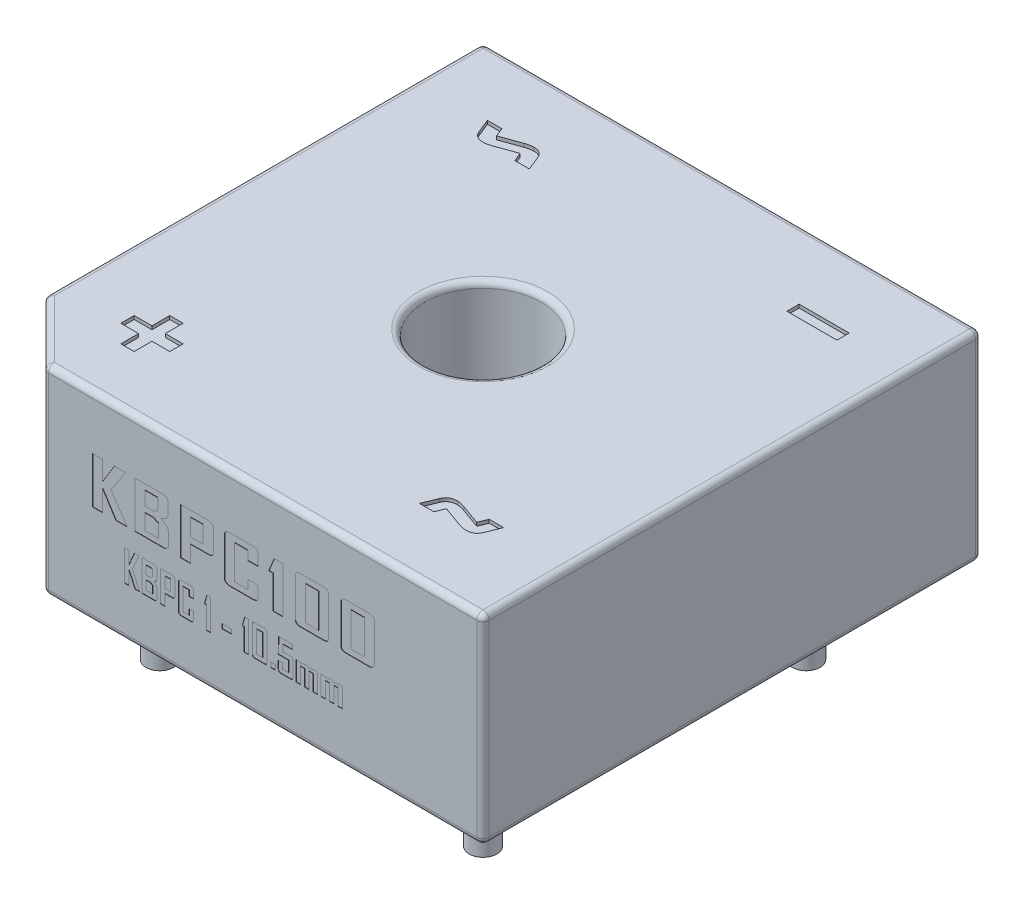
from build123d import *

# Parameters (mm, degrees)
BODY_SKETCH_R          = 1.9
BODY_MAIN_DEPTH        = 6.5
BODY_CHAMFER_SIZE      = 2
SKETCH24_R             = 2.399999999999998
BODY_CUT_DEPTH         = 2
BODY_REVOLVE_CUT_REACH = 24.048
BODY_FILLET_R          = 0.2
PIN_B1_SKETCH_R        = 0.45
CIRPATTERN1_COUNT      = 4
TEXT_START             = 2.84
TEXT_2_OUTLINE_W       = 0.4337349400000008
TEXT_2_OUTLINE_H       = 1.1024096379999997
TEXT_2_OUTLINE_W_2     = 0.3975903619999994
TEXT_2_OUTLINE_H_2     = 0.5602409640000001
TEXT_2_OUTLINE_W_3     = 0.18072289099999939
TEXT_2_OUTLINE_H_3     = 0.3493975909999998
TEXT_2_OUTLINE_W_4     = 0.1927710840000012
TEXT_2_OUTLINE_H_4     = 0.7108433739999998
TEXT_2_OUTLINE_W_5     = 0.14457831299999846
TEXT_2_OUTLINE_H_5     = 0.15662650599999983
TEXT_2_OUTLINE_W_6     = 0.3012048189999996
TEXT_2_OUTLINE_H_6     = 0.14457831399999987
TEXT_2_DEPTH           = 0.01
SKETCH23_W             = 1.6265060240963845
SKETCH23_H             = 0.39759036144578275
TEXT1_DEPTH            = 0.11
PIN1_MARK_DEPTH        = 0.04


# Read off the part's stored shape, not the designer's step: text
with BuildPart() as part:
    # BODY_Sketch → BODY_MAIN (new body)
    with BuildSketch(Plane(origin=(0, 0.1, 0), x_dir=(1, 0, 0), z_dir=(0, 1, 0))):
        Polygon((-2.8499999999999983, 13.35), (13.350000000000001, 13.350000000000001), (13.350000000000003, -2.8499999999999996), (-2.850000000000003, -2.8499999999999996), align=None)
        with Locations(Location((5.250000000000002, 5.249999999999999, 0), (0, 0, 90))):
            Circle(BODY_SKETCH_R, mode=Mode.SUBTRACT)
    extrude(amount=BODY_MAIN_DEPTH)

    # BODY_Chamfer
    body_chamfer_edges = [part.edges().sort_by_distance(p)[0] for p in [
        (-2.850000000000003, 3.35, 2.8499999999999996),
    ]]
    chamfer(body_chamfer_edges, length=BODY_CHAMFER_SIZE)

    # Sketch24 → BODY_Cut (cut)
    with BuildSketch(Plane(origin=(0, 0.1, 0), x_dir=(1, 0, 0), z_dir=(0, 1, 0))):
        Polygon((-0.4357864376269056, -1.8500000000000005), (12.350000000000003, -1.8499999999999996), (12.350000000000003, 12.35), (-1.8500000000000043, 12.349999999999996), (-1.8500000000000028, -0.43578643762689756), align=None)
        with Locations(Location((5.250000000000002, 5.249999999999999, 0), (0, 0, 270))):
            Circle(SKETCH24_R, mode=Mode.SUBTRACT)
    extrude(amount=BODY_CUT_DEPTH, mode=Mode.SUBTRACT)

    # Sketch26 → BODY_Revolve (revolve)
    with BuildSketch(Plane(origin=(0, 0, 0), x_dir=(0, -1, 0), z_dir=(0.707106781186546, 0, 0.707106781186549)), mode=Mode.PRIVATE) as body_revolve_sk:
        with BuildLine():
            Line((-0.39999999999999997, 17.46553749530773), (-2.3, 17.46553749530773))
            Line((-2.3, 17.46553749530773), (-2.299999999999999, 9.82462120245875))
            Line((-2.299999999999999, 9.82462120245875), (-0.39999999999999997, 9.82462120245875))
            add(Edge.make_bspline(
                [(-0.39999999999999997, 17.46553749530773), (-0.39999999999999997, 16.813199498951743), (-0.7883895517261408, 13.473585710075339), (-3.4344289772850907, 10.457207300253984), (-0.39999999999999997, 9.82462120245875)],
                knots=[0, 0, 0, 0, 0.3191160015862243, 1, 1, 1, 1], degree=3))
        make_face()
    revolve(body_revolve_sk.sketch.rotate(Axis((5.250000000000002, 10.74916955753597, -5.249999999999999), (0, -1, 0)), 135), axis=Axis((5.250000000000002, 10.74916955753597, -5.249999999999999), (0, -1, 0)))

    # Sketch28 → BODY_Revolve_Cut (cut, up to next)
    with BuildSketch(Plane(origin=(0, 2.2999999999999994, 0), x_dir=(1, 0, 0), z_dir=(0, 1, 0)), mode=Mode.PRIVATE) as body_revolve_cut_sk1:
        with BuildLine():
            Line((-2.8499999999999974, -0.6838014796587246), (-2.8499999999999956, 11.183801479658726))
            ThreePointArc((-2.8499999999999956, 11.183801479658726), (-4.790916292848976, 5.25), (-2.8499999999999974, -0.6838014796587246))
        make_face()
    body_revolve_cut_tool1 = extrude(body_revolve_cut_sk1.sketch, amount=-BODY_REVOLVE_CUT_REACH, mode=Mode.PRIVATE) & part.part
    # Sketch28 → BODY_Revolve_Cut (cut, up to next)
    with BuildSketch(Plane(origin=(0, 2.2999999999999994, 0), x_dir=(1, 0, 0), z_dir=(0, 1, 0)), mode=Mode.PRIVATE) as body_revolve_cut_sk2:
        with BuildLine():
            Line((13.350000000000001, 11.183801479658724), (13.350000000000005, -0.6838014796587202))
            ThreePointArc((13.350000000000005, -0.6838014796587202), (15.29091629284898, 5.250000000000003), (13.350000000000001, 11.183801479658724))
        make_face()
    body_revolve_cut_tool2 = extrude(body_revolve_cut_sk2.sketch, amount=-BODY_REVOLVE_CUT_REACH, mode=Mode.PRIVATE) & part.part
    # Sketch28 → BODY_Revolve_Cut (cut, up to next)
    with BuildSketch(Plane(origin=(0, 2.2999999999999994, 0), x_dir=(1, 0, 0), z_dir=(0, 1, 0)), mode=Mode.PRIVATE) as body_revolve_cut_sk3:
        with BuildLine():
            Line((11.183801479658733, -2.8499999999999948), (-0.6838014796587237, -2.8499999999999983))
            ThreePointArc((-0.6838014796587237, -2.8499999999999983), (5.250000000000004, -4.790916292848979), (11.183801479658733, -2.8499999999999948))
        make_face()
    body_revolve_cut_tool3 = extrude(body_revolve_cut_sk3.sketch, amount=-BODY_REVOLVE_CUT_REACH, mode=Mode.PRIVATE) & part.part
    # Sketch28 → BODY_Revolve_Cut (cut, up to next)
    with BuildSketch(Plane(origin=(0, 2.2999999999999994, 0), x_dir=(1, 0, 0), z_dir=(0, 1, 0)), mode=Mode.PRIVATE) as body_revolve_cut_sk4:
        with BuildLine():
            ThreePointArc((11.183801479658726, 13.350000000000001), (5.249999999999998, 15.29091629284898), (-0.6838014796587297, 13.349999999999994))
            Line((-0.6838014796587297, 13.349999999999994), (11.183801479658726, 13.350000000000001))
        make_face()
    body_revolve_cut_tool4 = extrude(body_revolve_cut_sk4.sketch, amount=-BODY_REVOLVE_CUT_REACH, mode=Mode.PRIVATE) & part.part
    add(body_revolve_cut_tool1.solids().sort_by_distance((-3.63318, 2.3, -5.25))[0], mode=Mode.SUBTRACT)
    add(body_revolve_cut_tool2.solids().sort_by_distance((14.13318, 2.3, -5.25))[0], mode=Mode.SUBTRACT)
    add(body_revolve_cut_tool3.solids().sort_by_distance((5.25, 2.3, 3.63318))[0], mode=Mode.SUBTRACT)
    add(body_revolve_cut_tool4.solids().sort_by_distance((5.25, 2.3, -14.13318))[0], mode=Mode.SUBTRACT)

    # BODY_Fillet
    body_fillet_edges = [part.edges().sort_by_distance(p)[0] for p in [
        (5.250000000000002, 6.6, -3.349999999999999),
        (13.350000000000001, 6.6, -5.25),
        (5.250000000000002, 6.6, -13.350000000000001),
        (6.250000000000001, 0.1, 2.8499999999999996),
        (6.250000000000001, 6.6, 2.8499999999999996),
        (-0.8500000000000032, 3.35, 2.8499999999999996),
        (-1.850000000000003, 0.1, 1.8499999999999994),
        (-2.8500000000000028, 3.35, 0.8499999999999996),
        (-1.850000000000003, 6.6, 1.8499999999999994),
        (-2.8500000000000005, 6.6, -6.249999999999998),
        (5.250000000000002, 0.1, -13.350000000000001),
        (13.350000000000001, 0.1, -5.25),
        (-2.8500000000000005, 0.1, -6.249999999999998),
        (-2.8499999999999983, 3.35, -13.35),
        (13.350000000000001, 3.35, -13.350000000000001),
        (13.350000000000003, 3.35, 2.8499999999999996),
    ]]
    fillet(body_fillet_edges, radius=BODY_FILLET_R)

    # PIN_Sweep: sweep along a path in PIN_B1_Path
    with BuildLine(Plane(origin=(0, 0, 0), x_dir=(0, 0, -1), z_dir=(1, 0, 0))) as pin_sweep_path:
        Line((0, -2.7), (0, 0))
        Line((0, 0), (0, 3.35))
    # PIN_B1_Sketch → PIN_Sweep (sweep)
    with BuildSketch(Plane(origin=(0, 0, 0), x_dir=(1, 0, 0), z_dir=(0, 1, 0))):
        Circle(PIN_B1_SKETCH_R)
    pin_sweep = sweep(path=pin_sweep_path.line)

    # CirPattern1: PIN_Sweep ×4 about axis
    cirpattern1_axis = Axis((5.249999999999993, 0, -5.25000000000001), (0, 1, 0))
    for i in range(1, CIRPATTERN1_COUNT):
        add(pin_sweep.rotate(cirpattern1_axis, i * 360 / CIRPATTERN1_COUNT))

    # text 2 outline → text 2 (cut)
    # profile 1 of 19: a face of its own
    with BuildSketch(Plane.XY.offset(TEXT_START)):
        with BuildLine():
            add(Edge.make_bspline(
                [(8.225903614, 2.330421687), (8.24190584768579, 2.33393243810223), (8.27385045293119, 2.34094080778165), (8.30578636434366, 2.34798868768132), (8.321724398, 2.351506024)],
                knots=[0, 0, 0, 0, 0.500936953361181, 1, 1, 1, 1], degree=3))
            Line((8.225903614, 2.330421687), (8.225903614, 2.363554217))
            Line((8.225903614, 2.363554217), (8.081325301, 2.363554217))
            Line((8.081325301, 2.363554217), (8.081325301, 1.725))
            Line((8.081325301, 1.725), (8.225903614, 1.725))
            Line((8.225903614, 1.725), (8.225903614, 2.241566265))
            Line((8.225903614, 2.241566265), (8.358433735, 2.243072289))
            Line((8.358433735, 2.243072289), (8.358433735, 1.725))
            Line((8.358433735, 1.725), (8.503012048, 1.725))
            Line((8.503012048, 1.725), (8.503012048, 2.241566265))
            Line((8.503012048, 2.241566265), (8.635542169, 2.243072289))
            Line((8.635542169, 2.243072289), (8.635542169, 1.725))
            Line((8.635542169, 1.725), (8.780120482, 1.725))
            Line((8.780120482, 1.725), (8.780120482, 2.284676205))
            add(Edge.make_bspline(
                [(8.695783133, 2.363554217), (8.70226776068473, 2.36325355288355), (8.71455329959077, 2.3626839259159), (8.73173832037393, 2.35878163217726), (8.74639139951268, 2.35231833357494), (8.75859339727807, 2.34357000728016), (8.76817915930402, 2.33220318329239), (8.7749263598296, 2.31836984299257), (8.77906801711136, 2.30222464266363), (8.77975763350906, 2.29072621506447), (8.780120482, 2.284676205)],
                knots=[0, 0, 0, 0, 0.148290832231006, 0.280946377394036, 0.400455298252146, 0.512425210819121, 0.621411208360218, 0.736958175519038, 0.861597969000499, 1, 1, 1, 1], degree=3))
            add(Edge.make_bspline(
                [(8.592055723, 2.349246988), (8.60264748505904, 2.35138960275253), (8.62252258457003, 2.35541015020298), (8.6504509071617, 2.35996172030027), (8.67445248768333, 2.36281978292006), (8.68912569488446, 2.36332499509547), (8.695783133, 2.363554217)],
                knots=[0, 0, 0, 0, 0.309141696941326, 0.580094406630043, 0.809483007592707, 1, 1, 1, 1], degree=3))
            add(Edge.make_bspline(
                [(8.489646084, 2.327786145), (8.50672064648074, 2.33127018950451), (8.54089499202703, 2.33824342572614), (8.57499375744337, 2.34557732969383), (8.592055723, 2.349246988)],
                knots=[0, 0, 0, 0, 0.499630991331246, 1, 1, 1, 1], degree=3))
            add(Edge.make_bspline(
                [(8.418674699, 2.363554217), (8.42307398444154, 2.36345916316602), (8.43146915671051, 2.36327777185329), (8.44345946533576, 2.36154937926013), (8.45425247825625, 2.35882831102509), (8.46376034511574, 2.35477784178207), (8.47229204843807, 2.34992069330966), (8.47939286918083, 2.34363073126407), (8.48553600423765, 2.3363675507827), (8.48825828656351, 2.33068371740852), (8.489646084, 2.327786145)],
                knots=[0, 0, 0, 0, 0.156270314249307, 0.29821119020433, 0.429671568138866, 0.550627586343719, 0.664617534396412, 0.776870433033137, 0.886250329962607, 1, 1, 1, 1], degree=3))
            add(Edge.make_bspline(
                [(8.321724398, 2.351506024), (8.33099710542357, 2.35334661551598), (8.34873221052587, 2.3568669552985), (8.37423996266241, 2.36057801581408), (8.3972910400412, 2.36304869994827), (8.41182954225714, 2.3633923950537), (8.418674699, 2.363554217)],
                knots=[0, 0, 0, 0, 0.289803377693954, 0.554281818736332, 0.790142706773658, 1, 1, 1, 1], degree=3))
        make_face()
    # profile 2 of 19: a face of its own
    with BuildSketch(Plane.XY.offset(TEXT_START)):
        with BuildLine():
            add(Edge.make_bspline(
                [(7.418674699, 2.330421687), (7.43467693202314, 2.33393243810223), (7.46662153726854, 2.34094080778165), (7.49855744868101, 2.34798868768132), (7.514495482, 2.351506024)],
                knots=[0, 0, 0, 0, 0.500936953361177, 1, 1, 1, 1], degree=3))
            Line((7.418674699, 2.330421687), (7.418674699, 2.363554217))
            Line((7.418674699, 2.363554217), (7.274096386, 2.363554217))
            Line((7.274096386, 2.363554217), (7.274096386, 1.725))
            Line((7.274096386, 1.725), (7.418674699, 1.725))
            Line((7.418674699, 1.725), (7.418674699, 2.241566265))
            Line((7.418674699, 2.241566265), (7.551204819, 2.243072289))
            Line((7.551204819, 2.243072289), (7.551204819, 1.725))
            Line((7.551204819, 1.725), (7.695783133, 1.725))
            Line((7.695783133, 1.725), (7.695783133, 2.241566265))
            Line((7.695783133, 2.241566265), (7.828313253, 2.243072289))
            Line((7.828313253, 2.243072289), (7.828313253, 1.725))
            Line((7.828313253, 1.725), (7.972891566, 1.725))
            Line((7.972891566, 1.725), (7.972891566, 2.284676205))
            add(Edge.make_bspline(
                [(7.888554217, 2.363554217), (7.89503884502207, 2.36325355288355), (7.90732438392812, 2.3626839259159), (7.92450940471128, 2.35878163217726), (7.93916248385003, 2.35231833357494), (7.95136448161541, 2.34357000728016), (7.96095024364137, 2.33220318329239), (7.96769744416695, 2.31836984299257), (7.97183910144871, 2.30222464266363), (7.97252871784641, 2.29072621506447), (7.972891566, 2.284676205)],
                knots=[0, 0, 0, 0, 0.148290832231005, 0.280946377394034, 0.400455298252144, 0.512425210819117, 0.621411208360223, 0.736958175519036, 0.8615979690005, 1, 1, 1, 1], degree=3))
            add(Edge.make_bspline(
                [(7.784826807, 2.349246988), (7.79541856939639, 2.35138960275253), (7.81529366890739, 2.35541015020298), (7.84322199149905, 2.35996172030027), (7.86722357202068, 2.36281978292006), (7.8818967792218, 2.36332499509547), (7.888554217, 2.363554217)],
                knots=[0, 0, 0, 0, 0.309141696941331, 0.580094406630036, 0.809483007592721, 1, 1, 1, 1], degree=3))
            add(Edge.make_bspline(
                [(7.682417169, 2.327786145), (7.69949173081809, 2.33127018950451), (7.73366607636438, 2.33824342572614), (7.76776484178072, 2.34557732969383), (7.784826807, 2.349246988)],
                knots=[0, 0, 0, 0, 0.499630991331243, 1, 1, 1, 1], degree=3))
            add(Edge.make_bspline(
                [(7.611445783, 2.363554217), (7.61584506877889, 2.36345916316602), (7.62424024104786, 2.36327777185329), (7.63623054967311, 2.36154937926013), (7.6470235625936, 2.35882831102509), (7.65653142945309, 2.35477784178208), (7.66506313277541, 2.34992069330966), (7.67216395351818, 2.34363073126407), (7.678307088575, 2.3363675507827), (7.68102937090086, 2.33068371740852), (7.682417169, 2.327786145)],
                knots=[0, 0, 0, 0, 0.156270314249308, 0.298211190204312, 0.429671568138869, 0.550627586343714, 0.664617534396416, 0.776870433033127, 0.886250329962611, 1, 1, 1, 1], degree=3))
            add(Edge.make_bspline(
                [(7.514495482, 2.351506024), (7.52376818976092, 2.35334661551598), (7.54150329486322, 2.3568669552985), (7.56701104699976, 2.36057801581408), (7.59006212437855, 2.36304869994827), (7.60460062659449, 2.3633923950537), (7.611445783, 2.363554217)],
                knots=[0, 0, 0, 0, 0.289803377693954, 0.554281818736314, 0.790142706773641, 1, 1, 1, 1], degree=3))
        make_face()
    # profile 3 of 19: a face of its own
    with BuildSketch(Plane.XY.offset(TEXT_START)):
        with BuildLine():
            add(Edge.make_bspline(
                [(2.756024096, 1.803878012), (2.75559879858627, 1.79788560457128), (2.75479550749926, 1.7865673059012), (2.75053333728877, 1.77078821280164), (2.74427941201808, 1.75706560178845), (2.73505939260662, 1.74596470377893), (2.72395849459709, 1.73674468436746), (2.71023588358391, 1.73049075909677), (2.69445679048435, 1.72622858888628), (2.68313849181426, 1.72542529779928), (2.677146084, 1.725)],
                knots=[0, 0, 0, 0, 0.143087679268516, 0.270260174430613, 0.388177209713557, 0.5, 0.611822790286443, 0.729739825569386, 0.856912320731484, 1, 1, 1, 1], degree=3))
            Line((2.756024096, 1.803878012), (2.756024096, 2.083245482))
            add(Edge.make_bspline(
                [(2.722703313, 2.174548193), (2.72781842035597, 2.1686584188302), (2.73814232169366, 2.15677099519602), (2.74865968905762, 2.13485982670836), (2.7549988592483, 2.11002230482141), (2.75567171297743, 2.09244892156813), (2.756024096, 2.083245482)],
                knots=[0, 0, 0, 0, 0.233880582320335, 0.472044867893607, 0.7235021212956, 1, 1, 1, 1], degree=3))
            add(Edge.make_bspline(
                [(2.645143072, 2.231024096), (2.65091855466293, 2.22694867983093), (2.66173038487503, 2.21931941027723), (2.6768044212292, 2.20860784160626), (2.68961689740409, 2.19931160996563), (2.70041996202014, 2.191631346823), (2.70902816968494, 2.18521987589506), (2.71557651467794, 2.18036137158709), (2.71999642002701, 2.1770709770193), (2.72202055077172, 2.17518451725427), (2.722703313, 2.174548193)],
                knots=[0, 0, 0, 0, 0.220969594522985, 0.413659947932666, 0.578075155223177, 0.715809510259433, 0.828017935537188, 0.913546243142883, 0.970838157711319, 1, 1, 1, 1], degree=3))
            add(Edge.make_bspline(
                [(2.720256024, 2.285240964), (2.71957651416631, 2.28460039570173), (2.71758970104083, 2.28272744409473), (2.71320318027765, 2.27974556055693), (2.70690712124066, 2.2751403827941), (2.69877022531476, 2.26882415263679), (2.68804925739044, 2.26171883520456), (2.67575613429082, 2.25244822216429), (2.66106218873843, 2.24228393443886), (2.650657891934, 2.23492481388403), (2.645143072, 2.231024096)],
                knots=[0, 0, 0, 0, 0.0302026419391957, 0.0883092398981999, 0.171209504373829, 0.282950229840026, 0.421594496871916, 0.587395025823174, 0.781297856076047, 1, 1, 1, 1], degree=3))
            add(Edge.make_bspline(
                [(2.750941265, 2.372402108), (2.75064892653445, 2.3635104208022), (2.75009224757558, 2.3465786277724), (2.74402464646729, 2.32282169082364), (2.73469968433851, 2.30182472168322), (2.7250042767943, 2.29069275872788), (2.720256024, 2.285240964)],
                knots=[0, 0, 0, 0, 0.280887719554825, 0.534874022704701, 0.772208061755555, 1, 1, 1, 1], degree=3))
            Line((2.750941265, 2.372402108), (2.750941265, 2.646121988))
            add(Edge.make_bspline(
                [(2.674510542, 2.725), (2.68031294571671, 2.72456703565141), (2.69131758504206, 2.72374589033506), (2.70663579450862, 2.7195603690266), (2.7198668553339, 2.71318436384829), (2.73058993785839, 2.70403374858835), (2.73933101114601, 2.69280463924752), (2.74571193811479, 2.67925787798902), (2.749639195111, 2.66339403297413), (2.75049011585042, 2.65210651241494), (2.750941265, 2.646121988)],
                knots=[0, 0, 0, 0, 0.140866030848222, 0.267161677026218, 0.382887923616369, 0.494174249189976, 0.605917690048943, 0.725745796488272, 0.854593311132678, 1, 1, 1, 1], degree=3))
            Line((2.674510542, 2.725), (2.262048193, 2.725))
            Line((2.262048193, 2.725), (2.262048193, 1.725))
            Line((2.262048193, 1.725), (2.677146084, 1.725))
        make_face()
        Polygon((2.406626506, 1.869578313), (2.406626506, 2.15873494), (2.537085843, 2.15873494), (2.611445783, 2.116566265), (2.611445783, 1.869578313), align=None, mode=Mode.SUBTRACT)
        Polygon((2.606362952, 2.351694277), (2.534638554, 2.303313253), (2.406626506, 2.303313253), (2.406626506, 2.580421687), (2.606362952, 2.580421687), align=None, mode=Mode.SUBTRACT)
    # profile 4 of 19: a face of its own
    with BuildSketch(Plane.XY.offset(TEXT_START)):
        with BuildLine():
            add(Edge.make_bspline(
                [(9.818674699, 3.468317018), (9.8179099073138, 3.45927836518683), (9.8164430374544, 3.44194223133854), (9.80682840721585, 3.4179902618543), (9.79252116220684, 3.39723981914659), (9.77212016335209, 3.38074498502072), (9.74709686276185, 3.36726522178644), (9.71666660256924, 3.35805874977808), (9.68130254074218, 3.35183938714248), (9.65596033151996, 3.35063900240613), (9.64246988, 3.35)],
                knots=[0, 0, 0, 0, 0.11409833725196, 0.218840580729786, 0.322174175098222, 0.429434411702991, 0.547100707621026, 0.679564678015938, 0.829422238091859, 1, 1, 1, 1], degree=3))
            Line((9.818674699, 3.468317018), (9.818674699, 4.731682982))
            add(Edge.make_bspline(
                [(9.64246988, 4.85), (9.65596033151996, 4.84936099759387), (9.68130254074218, 4.84816061285752), (9.71666660256923, 4.84194125022192), (9.74709686276186, 4.83273477821356), (9.77212016335208, 4.81925501497928), (9.79252116220685, 4.80276018085341), (9.80682840721586, 4.78200973814569), (9.8164430374544, 4.75805776866146), (9.8179099073138, 4.74072163481317), (9.818674699, 4.731682982)],
                knots=[0, 0, 0, 0, 0.17057776190814, 0.320435321984061, 0.452899292378973, 0.57056558829701, 0.677825824901779, 0.781159419270213, 0.885901662748038, 1, 1, 1, 1], degree=3))
            Line((9.64246988, 4.85), (8.914777861, 4.85))
            add(Edge.make_bspline(
                [(8.734337349, 4.731682982), (8.73507654022301, 4.74073113617952), (8.73649714846614, 4.75812026233382), (8.74650612757087, 4.78202464607385), (8.76108420706564, 4.80287402614466), (8.78207431801412, 4.81924468779656), (8.80762809177734, 4.83272982903761), (8.83879080950893, 4.84200922633129), (8.875016107839, 4.84812164194811), (8.90100750118189, 4.84934948374423), (8.914777861, 4.85)],
                knots=[0, 0, 0, 0, 0.112348160712769, 0.215915454739921, 0.318343110637888, 0.425762474467419, 0.543690883577195, 0.676356301576123, 0.828532073458312, 1, 1, 1, 1], degree=3))
            Line((8.734337349, 4.731682982), (8.734337349, 3.468317018))
            add(Edge.make_bspline(
                [(8.910542169, 3.35), (8.89705171667282, 3.35063900240613), (8.87170950745061, 3.35183938714248), (8.83634544562355, 3.35805874977808), (8.80591518543092, 3.36726522178644), (8.78089188484069, 3.38074498502072), (8.76049088598593, 3.39723981914659), (8.74618364097692, 3.41799026185431), (8.73656901073837, 3.44194223133854), (8.73510214087898, 3.45927836518683), (8.734337349, 3.468317018)],
                knots=[0, 0, 0, 0, 0.17057776190814, 0.320435321984062, 0.452899292378974, 0.570565588297015, 0.677825824901779, 0.781159419270214, 0.88590166274804, 1, 1, 1, 1], degree=3))
            Line((8.910542169, 3.35), (9.64246988, 3.35))
        make_face()
        with Locations((9.276506024, 4.1000000000000005)):
            Rectangle(TEXT_2_OUTLINE_W, TEXT_2_OUTLINE_H, mode=Mode.SUBTRACT)
    # profile 5 of 19: a face of its own
    with BuildSketch(Plane.XY.offset(TEXT_START)):
        with BuildLine():
            add(Edge.make_bspline(
                [(8.334939759, 3.468317018), (8.33417496755477, 3.45927836518683), (8.33270809769537, 3.44194223133854), (8.32309346745682, 3.41799026185431), (8.3087862224478, 3.39723981914659), (8.28838522359305, 3.38074498502072), (8.26336192300282, 3.36726522178644), (8.2329316628102, 3.35805874977807), (8.19756760098314, 3.35183938714248), (8.17222539176092, 3.35063900240613), (8.15873494, 3.35)],
                knots=[0, 0, 0, 0, 0.114098337251959, 0.218840580729787, 0.322174175098222, 0.429434411702986, 0.547100707621027, 0.679564678015939, 0.829422238091853, 1, 1, 1, 1], degree=3))
            Line((8.334939759, 3.468317018), (8.334939759, 4.731682982))
            add(Edge.make_bspline(
                [(8.15873494, 4.85), (8.17222539176092, 4.84936099759387), (8.19756760098314, 4.84816061285752), (8.2329316628102, 4.84194125022192), (8.26336192300282, 4.83273477821356), (8.28838522359305, 4.81925501497928), (8.30878622244781, 4.80276018085341), (8.32309346745682, 4.78200973814569), (8.33270809769537, 4.75805776866146), (8.33417496755477, 4.74072163481317), (8.334939759, 4.731682982)],
                knots=[0, 0, 0, 0, 0.170577761908147, 0.32043532198406, 0.452899292378972, 0.570565588297015, 0.677825824901778, 0.781159419270211, 0.885901662748039, 1, 1, 1, 1], degree=3))
            Line((8.15873494, 4.85), (7.431042922, 4.85))
            add(Edge.make_bspline(
                [(7.25060241, 4.731682982), (7.25134160046397, 4.74073113617952), (7.2527622087071, 4.75812026233382), (7.26277118781183, 4.78202464607385), (7.2773492673066, 4.80287402614466), (7.29833937825508, 4.81924468779656), (7.3238931520183, 4.83272982903761), (7.35505586974989, 4.84200922633129), (7.39128116807996, 4.84812164194811), (7.41727256142286, 4.84934948374423), (7.431042922, 4.85)],
                knots=[0, 0, 0, 0, 0.112348160712769, 0.215915454739922, 0.318343110637891, 0.425762474467423, 0.543690883577197, 0.676356301576128, 0.828532073458315, 1, 1, 1, 1], degree=3))
            Line((7.25060241, 4.731682982), (7.25060241, 3.468317018))
            add(Edge.make_bspline(
                [(7.426807229, 3.35), (7.41331677691378, 3.35063900240613), (7.38797456769157, 3.35183938714248), (7.35261050586451, 3.35805874977808), (7.32218024567188, 3.36726522178644), (7.29715694508166, 3.38074498502072), (7.2767559462269, 3.39723981914659), (7.26244870121788, 3.41799026185431), (7.25283407097934, 3.44194223133854), (7.25136720111994, 3.45927836518683), (7.25060241, 3.468317018)],
                knots=[0, 0, 0, 0, 0.170577761908141, 0.320435321984062, 0.452899292378974, 0.570565588297013, 0.677825824901777, 0.781159419270214, 0.88590166274804, 1, 1, 1, 1], degree=3))
            Line((7.426807229, 3.35), (8.15873494, 3.35))
        make_face()
        with Locations((7.792771084, 4.1000000000000005)):
            Rectangle(TEXT_2_OUTLINE_W, TEXT_2_OUTLINE_H, mode=Mode.SUBTRACT)
    # profile 6 of 19: a face of its own
    with BuildSketch(Plane.XY.offset(TEXT_START)):
        with BuildLine():
            add(Edge.make_bspline(
                [(6.036144578, 3.468317018), (6.03537978683187, 3.45927836518683), (6.03391291697248, 3.44194223133854), (6.02429828673392, 3.4179902618543), (6.00999104172492, 3.3972398191466), (5.98959004287015, 3.38074498502072), (5.96456674227993, 3.36726522178644), (5.9341364820873, 3.35805874977807), (5.89877242026024, 3.35183938714248), (5.87343021103803, 3.35063900240613), (5.859939759, 3.35)],
                knots=[0, 0, 0, 0, 0.11409833725196, 0.218840580729786, 0.322174175098223, 0.429434411702987, 0.547100707621025, 0.679564678015938, 0.829422238091859, 1, 1, 1, 1], degree=3))
            Line((6.036144578, 3.468317018), (6.036144578, 3.837951807))
            Line((6.036144578, 3.837951807), (5.710843373, 3.837951807))
            Line((5.710843373, 3.837951807), (5.710843373, 3.548795181))
            Line((5.710843373, 3.548795181), (5.277108434, 3.548795181))
            Line((5.277108434, 3.548795181), (5.277108434, 4.651204819))
            Line((5.277108434, 4.651204819), (5.710843373, 4.651204819))
            Line((5.710843373, 4.651204819), (5.710843373, 4.362048193))
            Line((5.710843373, 4.362048193), (6.036144578, 4.362048193))
            Line((6.036144578, 4.362048193), (6.036144578, 4.731682982))
            add(Edge.make_bspline(
                [(5.859939759, 4.85), (5.87343021103803, 4.84936099759387), (5.89877242026024, 4.84816061285752), (5.9341364820873, 4.84194125022192), (5.96456674227993, 4.83273477821356), (5.98959004287016, 4.81925501497928), (6.00999104172491, 4.8027601808534), (6.02429828673393, 4.78200973814569), (6.03391291697247, 4.75805776866146), (6.03537978683187, 4.74072163481317), (6.036144578, 4.731682982)],
                knots=[0, 0, 0, 0, 0.17057776190814, 0.320435321984062, 0.452899292378973, 0.570565588297014, 0.677825824901777, 0.781159419270213, 0.885901662748039, 1, 1, 1, 1], degree=3))
            Line((5.859939759, 4.85), (5.128012048, 4.85))
            add(Edge.make_bspline(
                [(4.951807229, 4.731682982), (4.95257202039704, 4.74072163481317), (4.95403889025644, 4.75805776866146), (4.96365352049499, 4.78200973814569), (4.97796076550401, 4.8027601808534), (4.99836176435876, 4.81925501497928), (5.02338506494899, 4.83273477821356), (5.05381532514162, 4.84194125022192), (5.08917938696868, 4.84816061285752), (5.11452159619089, 4.84936099759387), (5.128012048, 4.85)],
                knots=[0, 0, 0, 0, 0.114098337251961, 0.218840580729787, 0.322174175098223, 0.429434411702986, 0.547100707621027, 0.679564678015938, 0.82942223809186, 1, 1, 1, 1], degree=3))
            Line((4.951807229, 4.731682982), (4.951807229, 3.468317018))
            add(Edge.make_bspline(
                [(5.128012048, 3.35), (5.11452159619089, 3.35063900240613), (5.08917938696868, 3.35183938714248), (5.05381532514162, 3.35805874977808), (5.02338506494899, 3.36726522178644), (4.99836176435876, 3.38074498502072), (4.977960765504, 3.39723981914659), (4.96365352049499, 3.41799026185431), (4.95403889025644, 3.44194223133854), (4.95257202039704, 3.45927836518683), (4.951807229, 3.468317018)],
                knots=[0, 0, 0, 0, 0.170577761908141, 0.320435321984062, 0.452899292378974, 0.570565588297013, 0.677825824901777, 0.781159419270214, 0.88590166274804, 1, 1, 1, 1], degree=3))
            Line((5.128012048, 3.35), (5.859939759, 3.35))
        make_face()
    # profile 7 of 19: a face of its own
    with BuildSketch(Plane.XY.offset(TEXT_START)):
        with BuildLine():
            add(Edge.make_bspline(
                [(4.588554217, 4.010485693), (4.58778942538609, 4.00144703988563), (4.58632255552669, 3.98411090603734), (4.57670792528814, 3.9601589365531), (4.56240068027913, 3.93940849384539), (4.54199968142437, 3.92291365971951), (4.51697638083414, 3.90943389648524), (4.48654612064152, 3.90022742447687), (4.45118205881446, 3.89400806184128), (4.42583984959224, 3.89280767710492), (4.412349398, 3.892168675)],
                knots=[0, 0, 0, 0, 0.114098337251957, 0.218840580729783, 0.322174175098224, 0.429434411702988, 0.547100707621026, 0.679564678015938, 0.82942223809186, 1, 1, 1, 1], degree=3))
            Line((4.588554217, 4.010485693), (4.588554217, 4.731682982))
            add(Edge.make_bspline(
                [(4.412349398, 4.85), (4.42583984959224, 4.84936099759387), (4.45118205881446, 4.84816061285752), (4.48654612064152, 4.84194125022193), (4.51697638083414, 4.83273477821356), (4.54199968142437, 4.81925501497928), (4.56240068027913, 4.80276018085341), (4.57670792528814, 4.78200973814569), (4.58632255552669, 4.75805776866146), (4.58778942538609, 4.74072163481317), (4.588554217, 4.731682982)],
                knots=[0, 0, 0, 0, 0.17057776190814, 0.320435321984061, 0.452899292378973, 0.570565588297013, 0.677825824901776, 0.781159419270214, 0.885901662748039, 1, 1, 1, 1], degree=3))
            Line((4.412349398, 4.85), (3.522289157, 4.85))
            Line((3.522289157, 4.85), (3.522289157, 3.35))
            Line((3.522289157, 3.35), (3.847590361, 3.35))
            Line((3.847590361, 3.35), (3.847590361, 3.892168675))
            Line((3.847590361, 3.892168675), (4.412349398, 3.892168675))
        make_face()
        with Locations((4.046385542, 4.371084337)):
            Rectangle(TEXT_2_OUTLINE_W_2, TEXT_2_OUTLINE_H_2, mode=Mode.SUBTRACT)
    # profile 8 of 19: a face of its own
    with BuildSketch(Plane.XY.offset(TEXT_START)):
        with BuildLine():
            add(Edge.make_bspline(
                [(3.122891566, 3.468317018), (3.12212677478368, 3.45927836518683), (3.12065990492428, 3.44194223133854), (3.11104527468574, 3.41799026185431), (3.09673802967672, 3.39723981914659), (3.07633703082196, 3.38074498502072), (3.05131373023174, 3.36726522178644), (3.02088347003911, 3.35805874977808), (2.98551940821205, 3.35183938714248), (2.96017719898983, 3.35063900240613), (2.946686747, 3.35)],
                knots=[0, 0, 0, 0, 0.11409833725196, 0.218840580729785, 0.322174175098223, 0.429434411702986, 0.547100707621025, 0.679564678015938, 0.829422238091858, 1, 1, 1, 1], degree=3))
            Line((3.122891566, 3.468317018), (3.122891566, 3.905440512))
            add(Edge.make_bspline(
                [(3.048060994, 4.042394578), (3.05401154864701, 4.0382089977666), (3.06568723937101, 4.02999639462888), (3.08084127651466, 4.01553380617591), (3.09384687853931, 4.00000865202808), (3.10454131725976, 3.98344890578083), (3.11301302746759, 3.96564595195349), (3.11839707806399, 3.94652504013862), (3.12238447106024, 3.92640625621397), (3.12272031040495, 3.91252104942219), (3.122891566, 3.905440512)],
                knots=[0, 0, 0, 0, 0.133657493198638, 0.262251779839709, 0.383948145475165, 0.505447312090025, 0.62394912083783, 0.74500341512913, 0.869968602088879, 1, 1, 1, 1], degree=3))
            add(Edge.make_bspline(
                [(2.872985693, 4.127108434), (2.88598023897382, 4.12100097143826), (2.91029181106488, 4.10957448469508), (2.94424511925898, 4.09342305665612), (2.97331868239393, 4.07956210347415), (2.99768502745027, 4.0680609854466), (3.01712612714214, 4.05845849589777), (3.03177571693974, 4.05105846533519), (3.04170269757462, 4.04621891748532), (3.04646962808286, 4.04335174081997), (3.048060994, 4.042394578)],
                knots=[0, 0, 0, 0, 0.221438921720741, 0.414291366946786, 0.579869791670808, 0.71817427734081, 0.829838972037163, 0.914235280028408, 0.971368777045542, 1, 1, 1, 1], degree=3))
            add(Edge.make_bspline(
                [(3.042131024, 4.208433735), (3.0405391926509, 4.20747758637532), (3.03595132616942, 4.20472184112193), (3.02647761402923, 4.20001015960354), (3.0122249456638, 4.19332839681578), (2.99360341103236, 4.18386585382163), (2.9698438480195, 4.17304747023083), (2.94184944515495, 4.15936801917303), (2.90899425458224, 4.14384558997021), (2.88551101152148, 4.1329303329244), (2.872985693, 4.127108434)],
                knots=[0, 0, 0, 0, 0.0296703147017864, 0.0855137286685058, 0.168947239274006, 0.281300739551582, 0.41925825044257, 0.586125271653568, 0.77925055402879, 1, 1, 1, 1], degree=3))
            add(Edge.make_bspline(
                [(3.111596386, 4.339175452), (3.1113600280832, 4.33229518451015), (3.11090097403481, 4.31893231214469), (3.10789022652052, 4.29940970011814), (3.10207697515515, 4.28127122196038), (3.09444046417454, 4.26419457984159), (3.08476389790953, 4.24818510082161), (3.07283656342555, 4.23342904179759), (3.05853448933567, 4.21999672342708), (3.04769070896362, 4.21235281979013), (3.042131024, 4.208433735)],
                knots=[0, 0, 0, 0, 0.133406508271164, 0.259102454276183, 0.38145593079069, 0.501515548292038, 0.621060989479912, 0.743032877034081, 0.86825109178607, 1, 1, 1, 1], degree=3))
            Line((3.111596386, 4.339175452), (3.111596386, 4.731682982))
            add(Edge.make_bspline(
                [(2.941039157, 4.85), (2.95406068720504, 4.84936098309934), (2.97856390001237, 4.84815851561596), (3.01279249275042, 4.84190675001643), (3.0423273909014, 4.83275911137461), (3.06653156568744, 4.81916485831244), (3.08635376037697, 4.80273940988954), (3.10002314441233, 4.78189578062353), (3.10931081603304, 4.75801023518648), (3.11081211455616, 4.74071692326699), (3.111596386, 4.731682982)],
                knots=[0, 0, 0, 0, 0.168128507706706, 0.316375143342002, 0.448176834022575, 0.565139626170127, 0.67282155202459, 0.776962353447103, 0.8834862272311, 1, 1, 1, 1], degree=3))
            Line((2.941039157, 4.85), (2.038554217, 4.85))
            Line((2.038554217, 4.85), (2.038554217, 3.35))
            Line((2.038554217, 3.35), (2.946686747, 3.35))
        make_face()
        Polygon((2.363855422, 3.530722892), (2.363855422, 4.036746988), (2.631551205, 4.036746988), (2.797590361, 3.963045934), (2.797590361, 3.530722892), align=None, mode=Mode.SUBTRACT)
        Polygon((2.786295181, 4.296253765), (2.625903614, 4.21746988), (2.363855422, 4.21746988), (2.363855422, 4.669277108), (2.786295181, 4.669277108), align=None, mode=Mode.SUBTRACT)
    # profile 9 of 19: a face of its own
    with BuildSketch(Plane.XY.offset(TEXT_START)):
        with BuildLine():
            add(Edge.make_bspline(
                [(3.334337349, 2.165323795), (3.33391205159832, 2.15933138770381), (3.33310876051131, 2.14801308903373), (3.32884659030082, 2.13223399593416), (3.32259266503013, 2.11851138492098), (3.31337264561867, 2.10741048691146), (3.30227174760914, 2.09819046749999), (3.28854913659596, 2.0919365422293), (3.27277004349639, 2.08767437201881), (3.26145174482631, 2.08687108093181), (3.255459337, 2.086445783)],
                knots=[0, 0, 0, 0, 0.143087679268516, 0.270260174430615, 0.388177209713559, 0.499999999999999, 0.61182279028644, 0.729739825569386, 0.856912320731487, 1, 1, 1, 1], degree=3))
            Line((3.334337349, 2.165323795), (3.334337349, 2.646121988))
            add(Edge.make_bspline(
                [(3.255459337, 2.725), (3.26145174482631, 2.72457470220073), (3.2727700434964, 2.72377141111372), (3.28854913659596, 2.71950924090323), (3.30227174760914, 2.71325531563254), (3.31337264561867, 2.70403529622107), (3.32259266503013, 2.69293439821155), (3.32884659030082, 2.67921178719837), (3.33310876051131, 2.6634326940988), (3.33391205159832, 2.65211439542872), (3.334337349, 2.646121988)],
                knots=[0, 0, 0, 0, 0.143087679268513, 0.270260174430614, 0.388177209713558, 0.500000000000001, 0.611822790286442, 0.729739825569386, 0.856912320731484, 1, 1, 1, 1], degree=3))
            Line((3.255459337, 2.725), (2.864457831, 2.725))
            Line((2.864457831, 2.725), (2.864457831, 1.725))
            Line((2.864457831, 1.725), (3.009036145, 1.725))
            Line((3.009036145, 1.725), (3.009036145, 2.086445783))
            Line((3.009036145, 2.086445783), (3.255459337, 2.086445783))
        make_face()
        with Locations((3.0993975904999997, 2.4057228915)):
            Rectangle(TEXT_2_OUTLINE_W_3, TEXT_2_OUTLINE_H_3, mode=Mode.SUBTRACT)
    # profile 10 of 19: a face of its own
    with BuildSketch(Plane.XY.offset(TEXT_START)):
        with BuildLine():
            add(Edge.make_bspline(
                [(3.948795181, 1.803878012), (3.94836988292362, 1.79788560457128), (3.94756659183661, 1.7865673059012), (3.94330442162612, 1.77078821280163), (3.93705049635543, 1.75706560178845), (3.92783047694397, 1.74596470377892), (3.91672957893444, 1.73674468436746), (3.90300696792126, 1.73049075909677), (3.8872278748217, 1.72622858888628), (3.87590957615161, 1.72542529779927), (3.869917169, 1.725)],
                knots=[0, 0, 0, 0, 0.143087679268516, 0.270260174430613, 0.388177209713557, 0.499999999999998, 0.61182279028644, 0.729739825569387, 0.856912320731485, 1, 1, 1, 1], degree=3))
            Line((3.948795181, 1.803878012), (3.948795181, 2.050301205))
            Line((3.948795181, 2.050301205), (3.804216867, 2.050301205))
            Line((3.804216867, 2.050301205), (3.804216867, 1.869578313))
            Line((3.804216867, 1.869578313), (3.59939759, 1.869578313))
            Line((3.59939759, 1.869578313), (3.59939759, 2.580421687))
            Line((3.59939759, 2.580421687), (3.804216867, 2.580421687))
            Line((3.804216867, 2.580421687), (3.804216867, 2.399698795))
            Line((3.804216867, 2.399698795), (3.948795181, 2.399698795))
            Line((3.948795181, 2.399698795), (3.948795181, 2.646121988))
            add(Edge.make_bspline(
                [(3.869917169, 2.725), (3.87590957615161, 2.72457470220072), (3.8872278748217, 2.72377141111372), (3.90300696792126, 2.71950924090323), (3.91672957893445, 2.71325531563254), (3.92783047694397, 2.70403529622107), (3.93705049635543, 2.69293439821155), (3.94330442162612, 2.67921178719837), (3.94756659183661, 2.6634326940988), (3.94836988292362, 2.65211439542872), (3.948795181, 2.646121988)],
                knots=[0, 0, 0, 0, 0.143087679268515, 0.270260174430613, 0.38817720971356, 0.500000000000005, 0.611822790286442, 0.729739825569387, 0.856912320731484, 1, 1, 1, 1], degree=3))
            Line((3.869917169, 2.725), (3.533697289, 2.725))
            add(Edge.make_bspline(
                [(3.454819277, 2.646121988), (3.45524457490771, 2.65211439542872), (3.45604786599472, 2.6634326940988), (3.46031003620521, 2.67921178719837), (3.4665639614759, 2.69293439821155), (3.47578398088736, 2.70403529622107), (3.48688487889688, 2.71325531563254), (3.50060748991007, 2.71950924090323), (3.51638658300963, 2.72377141111372), (3.52770488167971, 2.72457470220072), (3.533697289, 2.725)],
                knots=[0, 0, 0, 0, 0.143087679268516, 0.270260174430614, 0.388177209713557, 0.499999999999998, 0.611822790286443, 0.729739825569386, 0.856912320731484, 1, 1, 1, 1], degree=3))
            Line((3.454819277, 2.646121988), (3.454819277, 1.803878012))
            add(Edge.make_bspline(
                [(3.533697289, 1.725), (3.52770488167971, 1.72542529779927), (3.51638658300963, 1.72622858888628), (3.50060748991007, 1.73049075909677), (3.48688487889689, 1.73674468436746), (3.47578398088736, 1.74596470377892), (3.4665639614759, 1.75706560178845), (3.46031003620521, 1.77078821280163), (3.45604786599472, 1.7865673059012), (3.45524457490771, 1.79788560457128), (3.454819277, 1.803878012)],
                knots=[0, 0, 0, 0, 0.143087679268516, 0.270260174430614, 0.388177209713557, 0.5, 0.611822790286443, 0.729739825569387, 0.856912320731484, 1, 1, 1, 1], degree=3))
            Line((3.533697289, 1.725), (3.869917169, 1.725))
        make_face()
    # profile 11 of 19: a face of its own
    with BuildSketch(Plane.XY.offset(TEXT_START)):
        with BuildLine():
            add(Edge.make_bspline(
                [(6.334337349, 1.803878012), (6.33391205159832, 1.79788560457128), (6.33310876051131, 1.7865673059012), (6.32884659030082, 1.77078821280163), (6.32259266503013, 1.75706560178845), (6.31337264561867, 1.74596470377892), (6.30227174760914, 1.73674468436746), (6.28854913659596, 1.73049075909677), (6.2727700434964, 1.72622858888628), (6.26145174482631, 1.72542529779927), (6.255459337, 1.725)],
                knots=[0, 0, 0, 0, 0.143087679268517, 0.270260174430614, 0.38817720971356, 0.500000000000001, 0.611822790286444, 0.729739825569385, 0.856912320731487, 1, 1, 1, 1], degree=3))
            Line((6.334337349, 1.803878012), (6.334337349, 2.646121988))
            add(Edge.make_bspline(
                [(6.255459337, 2.725), (6.26145174482631, 2.72457470220073), (6.2727700434964, 2.72377141111372), (6.28854913659596, 2.71950924090323), (6.30227174760914, 2.71325531563254), (6.31337264561867, 2.70403529622108), (6.32259266503013, 2.69293439821155), (6.32884659030082, 2.67921178719837), (6.33310876051131, 2.6634326940988), (6.33391205159832, 2.65211439542872), (6.334337349, 2.646121988)],
                knots=[0, 0, 0, 0, 0.143087679268513, 0.270260174430615, 0.388177209713556, 0.500000000000001, 0.61182279028644, 0.729739825569386, 0.856912320731483, 1, 1, 1, 1], degree=3))
            Line((6.255459337, 2.725), (5.933358434, 2.725))
            add(Edge.make_bspline(
                [(5.852409639, 2.646121988), (5.85281794675875, 2.65211746646907), (5.85359027937515, 2.66345817321557), (5.8580845996947, 2.67924023550828), (5.86456495912578, 2.69287602358141), (5.87375976001115, 2.7041697062392), (5.88527394524051, 2.71324114556702), (5.8993861374786, 2.71954996388672), (5.91562345957428, 2.72374135622713), (5.92724375181543, 2.72456604355601), (5.933358434, 2.725)],
                knots=[0, 0, 0, 0, 0.141191734529437, 0.267070268322854, 0.384070853061274, 0.494411965595745, 0.607065163652025, 0.726092804856571, 0.855868050561088, 1, 1, 1, 1], degree=3))
            Line((5.852409639, 2.646121988), (5.852409639, 1.803878012))
            add(Edge.make_bspline(
                [(5.931287651, 1.725), (5.9252952431255, 1.72542529779928), (5.91397694445541, 1.72622858888628), (5.89819785135585, 1.73049075909677), (5.88447524034267, 1.73674468436746), (5.87337434233314, 1.74596470377893), (5.86415432292168, 1.75706560178845), (5.85790039765099, 1.77078821280163), (5.8536382274405, 1.7865673059012), (5.85283493635349, 1.79788560457128), (5.852409639, 1.803878012)],
                knots=[0, 0, 0, 0, 0.143087679268519, 0.270260174430613, 0.38817720971356, 0.499999999999997, 0.611822790286442, 0.729739825569387, 0.856912320731484, 1, 1, 1, 1], degree=3))
            Line((5.931287651, 1.725), (6.255459337, 1.725))
        make_face()
        with Locations((6.093373494, 2.225)):
            Rectangle(TEXT_2_OUTLINE_W_4, TEXT_2_OUTLINE_H_4, mode=Mode.SUBTRACT)
    # profile 12 of 19: a face of its own
    with BuildSketch(Plane.XY.offset(TEXT_START)):
        with BuildLine():
            add(Edge.make_bspline(
                [(7.177710843, 1.803878012), (7.17728554557422, 1.79788560457128), (7.17648225448721, 1.7865673059012), (7.17222008427672, 1.77078821280163), (7.16596615900603, 1.75706560178845), (7.15674613959457, 1.74596470377892), (7.14564524158505, 1.73674468436746), (7.13192263057186, 1.73049075909677), (7.1161435374723, 1.72622858888628), (7.10482523880221, 1.72542529779927), (7.098832831, 1.725)],
                knots=[0, 0, 0, 0, 0.143087679268516, 0.270260174430614, 0.388177209713556, 0.500000000000002, 0.611822790286445, 0.729739825569386, 0.856912320731488, 1, 1, 1, 1], degree=3))
            Line((7.177710843, 1.803878012), (7.177710843, 2.284676205))
            add(Edge.make_bspline(
                [(7.098832831, 2.363554217), (7.10482523880222, 2.3631289190682), (7.1161435374723, 2.36232562798119), (7.13192263057186, 2.3580634577707), (7.14564524158504, 2.35180953250001), (7.15674613959457, 2.34258951308854), (7.16596615900603, 2.33148861507902), (7.17222008427672, 2.31776600406584), (7.17648225448721, 2.30198691096627), (7.17728554557422, 2.29066861229619), (7.177710843, 2.284676205)],
                knots=[0, 0, 0, 0, 0.143087679268513, 0.270260174430613, 0.388177209713555, 0.499999999999999, 0.611822790286441, 0.729739825569383, 0.856912320731481, 1, 1, 1, 1], degree=3))
            Line((7.098832831, 2.363554217), (6.840361446, 2.363554217))
            Line((6.840361446, 2.363554217), (6.852409639, 2.580421687))
            Line((6.852409639, 2.580421687), (7.165662651, 2.580421687))
            Line((7.165662651, 2.580421687), (7.165662651, 2.725))
            Line((7.165662651, 2.725), (6.707831325, 2.725))
            Line((6.707831325, 2.725), (6.695783133, 2.218975904))
            Line((6.695783133, 2.218975904), (7.03313253, 2.218975904))
            Line((7.03313253, 2.218975904), (7.03313253, 1.869578313))
            Line((7.03313253, 1.869578313), (6.840361446, 1.869578313))
            Line((6.840361446, 1.869578313), (6.840361446, 2.050301205))
            Line((6.840361446, 2.050301205), (6.695783133, 2.050301205))
            Line((6.695783133, 2.050301205), (6.695783133, 1.803878012))
            add(Edge.make_bspline(
                [(6.774661145, 1.725), (6.7686687371014, 1.72542529779928), (6.75735043843132, 1.72622858888628), (6.74157134533176, 1.73049075909677), (6.72784873431857, 1.73674468436746), (6.71674783630904, 1.74596470377893), (6.70752781689759, 1.75706560178845), (6.70127389162689, 1.77078821280163), (6.6970117214164, 1.7865673059012), (6.69620843032939, 1.79788560457128), (6.695783133, 1.803878012)],
                knots=[0, 0, 0, 0, 0.143087679268519, 0.270260174430613, 0.38817720971356, 0.499999999999997, 0.611822790286442, 0.729739825569387, 0.856912320731484, 1, 1, 1, 1], degree=3))
            Line((6.774661145, 1.725), (7.098832831, 1.725))
        make_face()
    # profile 13 of 19: a face of its own
    with BuildSketch(Plane.XY.offset(TEXT_START)):
        Polygon((1.78373494, 3.35), (1.259638554, 4.136144578), (1.729518072, 4.839551958), (1.729518072, 4.85), (1.368072289, 4.85), (0.988554217, 4.223964608), (0.988554217, 4.85), (0.663253012, 4.85), (0.663253012, 3.35), (0.988554217, 3.35), (0.988554217, 4.028557982), (1.422289157, 3.35), align=None)
    # profile 14 of 19: a face of its own
    with BuildSketch(Plane.XY.offset(TEXT_START)):
        Polygon((6.525903614, 3.35), (6.851204819, 3.35), (6.851204819, 4.85), (6.569954819, 4.85), (6.39939759, 4.443373494), (6.39939759, 4.41626506), (6.525903614, 4.41626506), align=None)
    # profile 15 of 19: a face of its own
    with BuildSketch(Plane.XY.offset(TEXT_START)):
        Polygon((2.045180723, 1.725), (2.189759036, 1.725), (1.960843373, 2.249096386), (2.165662651, 2.718034639), (2.165662651, 2.725), (2.021084337, 2.725), (1.840361446, 2.307643072), (1.840361446, 2.725), (1.695783133, 2.725), (1.695783133, 1.725), (1.840361446, 1.725), (1.840361446, 2.177371988), align=None)
    # profile 16 of 19: a face of its own
    with BuildSketch(Plane.XY.offset(TEXT_START)):
        Polygon((4.358433735, 1.725), (4.503012048, 1.725), (4.503012048, 2.725), (4.378200301, 2.725), (4.298192771, 2.453915663), (4.298192771, 2.435843373), (4.358433735, 2.435843373), align=None)
    # profile 17 of 19: a face of its own
    with BuildSketch(Plane.XY.offset(TEXT_START)):
        Polygon((5.587349398, 1.725), (5.731927711, 1.725), (5.731927711, 2.725), (5.607115964, 2.725), (5.527108434, 2.453915663), (5.527108434, 2.435843373), (5.587349398, 2.435843373), align=None)
    # profile 18 of 19: a face of its own
    with BuildSketch(Plane.XY.offset(TEXT_START)):
        with Locations((6.5271084335, 1.803313253)):
            Rectangle(TEXT_2_OUTLINE_W_5, TEXT_2_OUTLINE_H_5)
    # profile 19 of 19: a face of its own
    with BuildSketch(Plane.XY.offset(TEXT_START)):
        with Locations((5.0271084335000005, 2.0984939760000003)):
            Rectangle(TEXT_2_OUTLINE_W_6, TEXT_2_OUTLINE_H_6)
    extrude(amount=TEXT_2_DEPTH, mode=Mode.SUBTRACT)

    # Sketch23 → text1 (cut)
    with BuildSketch(Plane(origin=(0, 6.6, 0), x_dir=(1, 0, 0), z_dir=(0, 1, 0))):
        Polygon((0.7951807228915662, -0.4746702580281667), (0.21686746987951805, -0.4746702580281667), (0.21686746987951805, -1.0529835110402148), (-0.21686746987951805, -1.0529835110402148), (-0.21686746987951805, -0.4746702580281667), (-0.7951807228915662, -0.4746702580281667), (-0.7951807228915662, -0.04093531826913064), (-0.21686746987951805, -0.04093531826913064), (-0.21686746987951805, 0.5373779347429177), (0.21686746987951805, 0.5373779347429177), (0.21686746987951805, -0.04093531826913064), (0.7951807228915662, -0.04093531826913064), align=None)
        with Locations((10.500000000000007, 10.884308812245035)):
            Rectangle(SKETCH23_W, SKETCH23_H)
        with BuildLine():
            add(Edge.make_bspline(
                [(1.3141942771084367, 10.96393983634142), (1.3062663469479394, 10.981927475108836), (1.2908272925752147, 11.016957063834385), (1.2591003207099967, 11.063484855528285), (1.2230873981201167, 11.103934773475688), (1.1802985690648233, 11.135758765925388), (1.1328678322387398, 11.160892300010348), (1.0803317701113593, 11.179004071960218), (1.022477730522706, 11.1899330698163), (0.9821661681272921, 11.19098903690808), (0.9612198795180753, 11.191537727907685)],
                knots=[0, 0, 0, 0, 1.0475525427071564, 2.040030668500208, 2.993409779038591, 3.926219190241939, 4.870493698388186, 5.849596394597669, 6.882628906733188, 8, 8, 8, 8], degree=3))
            add(Edge.make_bspline(
                [(0.9612198795180753, 11.191537727907685), (0.940099522401436, 11.190837484403762), (0.8965021888671645, 11.189392018807368), (0.8293703086653419, 11.178602590251273), (0.7590194621950607, 11.16104154138377), (0.7116798381168238, 11.145008906736198), (0.6873117469879547, 11.13675610140166)],
                knots=[0, 0, 0, 0, 0.9028309163811076, 1.8636531744773117, 2.9003145854903436, 4, 4, 4, 4], degree=3))
            Line((0.6873117469879547, 11.13675610140166), (0.03840361445783423, 10.90238110140166))
            Line((0.03840361445783423, 10.90238110140166), (-0.07906626506023812, 11.191537727907685))
            Line((-0.07906626506023812, 11.191537727907685), (-0.5489457831325272, 11.191537727907685))
            Line((-0.5489457831325272, 11.191537727907685), (-0.3614457831325272, 10.729000077305276))
            add(Edge.make_bspline(
                [(-0.3614457831325272, 10.729000077305276), (-0.3535025378571595, 10.711213199787707), (-0.33803175233477456, 10.676570310433586), (-0.3065819496747255, 10.63050512735829), (-0.2699583055858336, 10.591492698816067), (-0.22824456377815971, 10.559167937908649), (-0.18045028673010827, 10.534773617829725), (-0.12747219899669754, 10.517469276362855), (-0.06917130227151906, 10.506354049835606), (-0.028479751526254, 10.505325195156509), (-0.00734186746987665, 10.504790739955878)],
                knots=[0, 0, 0, 0, 1.040915042790157, 2.02735441444435, 2.9681817516597806, 3.8951506581936655, 4.836948532206222, 5.824621981955552, 6.869964710559326, 8, 8, 8, 8], degree=3))
            add(Edge.make_bspline(
                [(-0.00734186746987665, 10.504790739955878), (0.01302498579459645, 10.505502919988325), (0.05530901656600824, 10.506981491175328), (0.12057770029262141, 10.517710300285453), (0.189699898581646, 10.53557570994038), (0.23654029233894003, 10.551358245131349), (0.2609186746987981, 10.559572366461902)],
                knots=[0, 0, 0, 0, 0.888322291387575, 1.8442636482035373, 2.8780332350866282, 4, 4, 4, 4], degree=3))
            Line((0.2609186746987981, 10.559572366461902), (0.9132153614457859, 10.793947366461902))
            Line((0.9132153614457859, 10.793947366461902), (1.0306852409638583, 10.504790739955878))
            Line((1.0306852409638583, 10.504790739955878), (1.5005647590361475, 10.504790739955878))
            Line((1.5005647590361475, 10.504790739955878), (1.3141942771084367, 10.96393983634142))
        make_face()
        with BuildLine():
            add(Edge.make_bspline(
                [(10.988893072289159, -0.4639398363414198), (10.980965142128662, -0.48192747510883666), (10.965526087755936, -0.5169570638343842), (10.93379911589072, -0.5634848555282868), (10.897786193300837, -0.6039347734756891), (10.854997364245547, -0.6357587659253869), (10.807566627419462, -0.6608923000103504), (10.755030565292081, -0.6790040719602175), (10.697176525703428, -0.6899330698163002), (10.656864963308015, -0.6909890369080819), (10.635918674698798, -0.6915377279076848)],
                knots=[0, 0, 0, 0, 1.047552542707177, 2.0400306685002225, 2.9934097790386103, 3.9262191902419414, 4.870493698388197, 5.849596394597692, 6.882628906733204, 7.999999999999999, 7.999999999999999, 7.999999999999999, 7.999999999999999], degree=3))
            add(Edge.make_bspline(
                [(10.635918674698798, -0.6915377279076848), (10.614798317582158, -0.6908374844037631), (10.571200984047888, -0.6893920188073681), (10.504069103846065, -0.6786025902512727), (10.433718257375784, -0.6610415413837689), (10.386378633297547, -0.6450089067361979), (10.362010542168678, -0.6367561014016606)],
                knots=[0, 0, 0, 0, 0.9028309163811133, 1.863653174477318, 2.900314585490364, 4, 4, 4, 4], degree=3))
            Line((10.362010542168678, -0.6367561014016606), (9.713102409638557, -0.4023811014016608))
            Line((9.713102409638557, -0.4023811014016608), (9.595632530120485, -0.6915377279076848))
            Line((9.595632530120485, -0.6915377279076848), (9.125753012048195, -0.6915377279076848))
            Line((9.125753012048195, -0.6915377279076848), (9.313253012048195, -0.22900007730527505))
            add(Edge.make_bspline(
                [(9.313253012048195, -0.22900007730527505), (9.321196257323562, -0.21121319978770808), (9.336667042845948, -0.17657031043358623), (9.368116845505996, -0.13050512735829273), (9.40474048959489, -0.09149269881606518), (9.446454231402564, -0.05916793790865081), (9.494248508450614, -0.03477361782972425), (9.547226596184023, -0.01746927636285516), (9.605527492909202, -0.00635404983560385), (9.646219043654469, -0.00532519515650906), (9.667356927710847, -0.00479073995587756)],
                knots=[0, 0, 0, 0, 1.040915042790148, 2.027354414444333, 2.968181751659771, 3.8951506581936766, 4.8369485322062005, 5.824621981955545, 6.869964710559316, 8, 8, 8, 8], degree=3))
            add(Edge.make_bspline(
                [(9.667356927710847, -0.00479073995587756), (9.687723780975318, -0.00550291998832497), (9.73000781174673, -0.00698149117532912), (9.795276495473342, -0.01771030028545425), (9.864398693762368, -0.03557570994037817), (9.911239087519663, -0.05135824513134735), (9.935617469879519, -0.05957236646190176)],
                knots=[0, 0, 0, 0, 0.8883222913875665, 1.8442636482035364, 2.878033235086645, 4, 4, 4, 4], degree=3))
            Line((9.935617469879519, -0.05957236646190176), (10.587914156626507, -0.2939473664619018))
            Line((10.587914156626507, -0.2939473664619018), (10.705384036144581, -0.00479073995587756))
            Line((10.705384036144581, -0.00479073995587756), (11.175263554216869, -0.00479073995587756))
            Line((11.175263554216869, -0.00479073995587756), (10.988893072289159, -0.4639398363414198))
        make_face()
    extrude(amount=-TEXT1_DEPTH, mode=Mode.SUBTRACT)

    # Sketch16 → pin1_mark (cut)
    with BuildSketch(Plane(origin=(-1.8500000000000019, 5.3711239199988965, 1.8499999999999988), x_dir=(0.49999999999999883, -0.7071067811865483, 0.4999999999999999), z_dir=(0.7071067811865483, 0, -0.7071067811865468))):
        Polygon((2.6078884520933974, 3.2202608877892143), (3.220260887789193, 2.607888452093419), (3.4444047558312065, 3.4444047558312283), align=None)
        Polygon((1.39013939529456, 0.6024292053840301), (1.1250791543307046, 0.866359928275596), (1.389009877222271, 1.1314201692394517), (1.172142407342753, 1.3475346270707769), (0.9082116844511867, 1.0824743861069213), (0.6431514434873316, 1.346781615022584), (0.45113337119817476, 1.1540105306852344), (0.71619361216203, 0.8897033017695721), (0.45188638324636743, 0.6246430608057164), (0.6687538531258855, 0.40852860297439136), (0.933061082041548, 0.6735888439382467), (1.1981213230054033, 0.40965812104668053), align=None)
    extrude(amount=PIN1_MARK_DEPTH, mode=Mode.SUBTRACT)


solid = part.part
